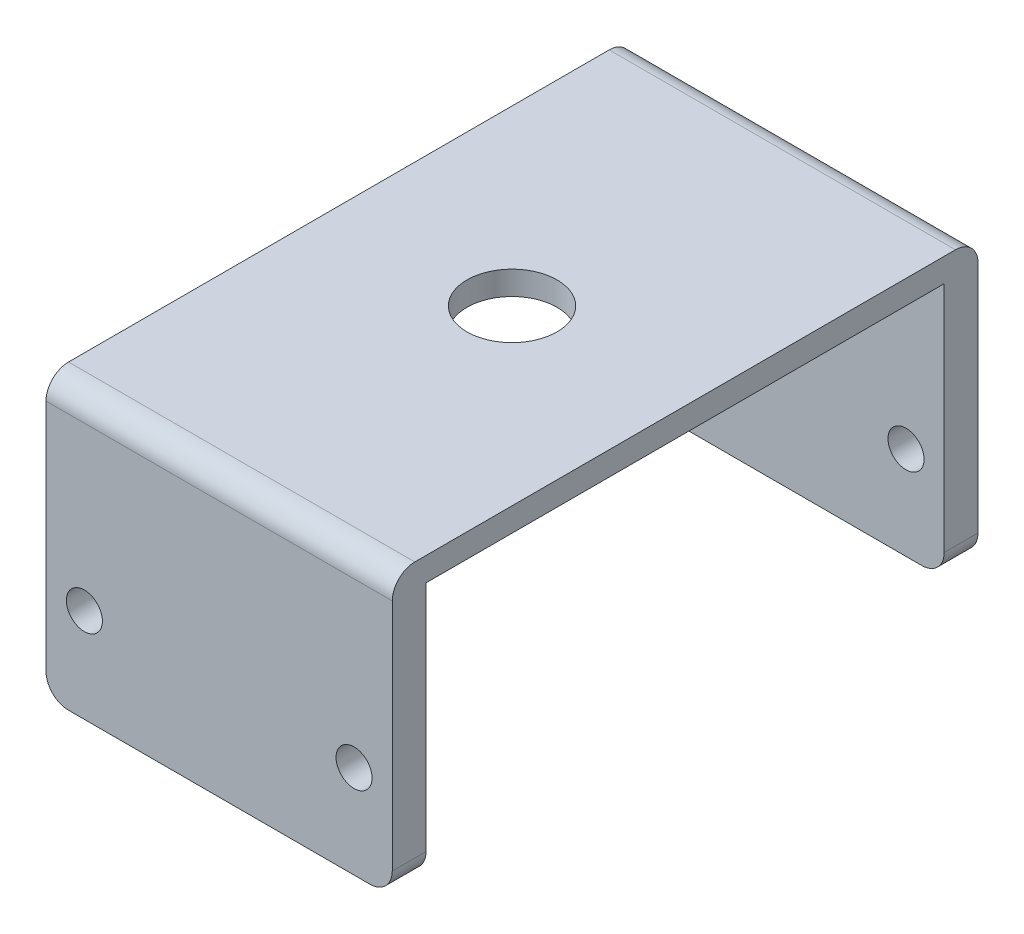
from build123d import *
from build123d.topology import SkipClean

# Parameters (mm, degrees)
SKETCH_1_W               = 30
SKETCH_1_H               = 65
EXTRUDE_1_DEPTH          = 48
SKETCH_2_R               = 1
CUT_EXTRUDE_1_DEPTH      = 48
EXTRUDE_2_DEPTH          = 5
EXTRUDE_2_DEPTH_BACK     = 53
SKETCH_3_R               = 3
CHAMFER_1_SIZE           = 2
FILLET_1_R               = 1
FILLET_2_R               = 1
SKETCH_6_R               = 1.6
CUT_EXTRUDE_3_DEPTH      = 76
EXTRUDE_3_DEPTH          = 50
EXTRUDE_3_DEPTH_BACK     = 2
SKETCH_7_W               = 30.741029275
SKETCH_7_H               = 24.773895079
SKETCH_7_R               = 1.6
CUT_EXTRUDE_START        = -30.741029275
CUT_EXTRUDE_4_DEPTH      = 30.741029275
CUT_EXTRUDE_5_DEPTH      = 50
CUT_EXTRUDE_5_DEPTH_BACK = 50
SKETCH_9_R               = 4
FILLET_3_R               = 2


# Read off the part's stored shape, not the designer's step: ｶｯﾄ - 押し出し4
with BuildPart() as part:
    # ｽｹｯﾁ1 → ﾎﾞｽ - 押し出し1 (new body)
    with BuildSketch(Plane.XY):
        with Locations((44.026916893, 39.150883092)):
            Rectangle(SKETCH_1_W, SKETCH_1_H)
    extrude(amount=EXTRUDE_1_DEPTH)

    # ｽｹｯﾁ2 → ｶｯﾄ - 押し出し1 (cut)
    with BuildSketch(Plane.XY):
        with Locations((56.026916893, 57.650883092)):
            Circle(SKETCH_2_R)
        with Locations((44.026916893, 57.650883092)):
            Circle(SKETCH_2_R)
        with Locations((56.023819064, 45.923533591)):
            Circle(SKETCH_2_R)
        with Locations((32.026916893, 57.650883092)):
            Circle(SKETCH_2_R)
        with Locations(Location((32.030014722, 45.923533591, 0), (0, 0, 180))):
            Circle(SKETCH_2_R)
    extrude(amount=CUT_EXTRUDE_1_DEPTH, mode=Mode.SUBTRACT)

    # ｽｹｯﾁ3 → ﾎﾞｽ - 押し出し2 (add, two sides: drawn at the far end of the back side and taken through both)
    with BuildSketch(Plane(origin=(0, 0, 0), x_dir=(-1, 0, 0), z_dir=(0, 0, -1)).offset(-EXTRUDE_2_DEPTH_BACK)):
        with Locations((-44.026916893, 18.650883092)):
            Circle(SKETCH_3_R)
    extrude(amount=EXTRUDE_2_DEPTH + EXTRUDE_2_DEPTH_BACK)

    # 面取り1
    chamfer_1_edges = [part.edges().sort_by_distance(p)[0] for p in [
        (29.026916893, 71.650883092, 24),
        (59.026916893, 71.650883092, 24),
        (59.026916893, 6.650883092, 24),
        (29.026916893, 6.650883092, 24),
    ]]
    chamfer(chamfer_1_edges, length=CHAMFER_1_SIZE)

    # ﾌｨﾚｯﾄ1
    fillet_1_edges = [part.edges().sort_by_distance(p)[0] for p in [
        (44.026916893, 6.650883092, 48),
        (29.026916893, 39.150883092, 48),
        (59.026916893, 39.150883092, 48),
        (44.026916893, 71.650883092, 48),
        (30.026916893, 70.650883092, 48),
        (58.026916893, 70.650883092, 48),
        (58.026916893, 7.650883092, 48),
        (30.026916893, 7.650883092, 48),
    ]]
    fillet(fillet_1_edges, radius=FILLET_1_R)

    # ﾌｨﾚｯﾄ2
    fillet_2_edges = [part.edges().sort_by_distance(p)[0] for p in [
        (44.026916893, 6.650883092, 0),
        (29.026916893, 39.150883092, 0),
        (44.026916893, 71.650883092, 0),
        (59.026916893, 39.150883092, 0),
        (30.026916893, 70.650883092, 0),
        (58.026916893, 70.650883092, 0),
        (58.026916893, 7.650883092, 0),
        (30.026916893, 7.650883092, 0),
    ]]
    fillet(fillet_2_edges, radius=FILLET_2_R)

    # ｽｹｯﾁ6 → ｶｯﾄ - 押し出し3 (cut)
    with BuildSketch(Plane(origin=(0, 0, 0), x_dir=(-1, 0, 0), z_dir=(0, 0, -1))):
        with Locations((-55.99912174, 57.606952707)):
            Circle(SKETCH_6_R)
        with Locations((-32.054712046, 57.694813478)):
            Circle(SKETCH_6_R)
        with Locations((-55.99912174, 45.879603206)):
            Circle(SKETCH_6_R)
        with Locations((-32.054712046, 45.967463976)):
            Circle(SKETCH_6_R)
    extrude(amount=-CUT_EXTRUDE_3_DEPTH, mode=Mode.SUBTRACT)

    # ｽｹｯﾁ7 → ﾎﾞｽ - 押し出し3 (add, two sides: drawn at the far end of the back side and taken through both)
    with SkipClean():  # the faces are left unmerged after this step: merging them gives an invalid solid
        with BuildSketch(Plane.XY.offset(-EXTRUDE_3_DEPTH_BACK)):
            with Locations((44.019576577, 61.733784516)):
                Rectangle(SKETCH_7_W, SKETCH_7_H)
            with Locations((32.054712046, 57.694813478)):
                Circle(SKETCH_7_R, mode=Mode.SUBTRACT)
            with Locations((55.99912174, 57.606952707)):
                Circle(SKETCH_7_R, mode=Mode.SUBTRACT)
        extrude(amount=EXTRUDE_3_DEPTH + EXTRUDE_3_DEPTH_BACK)

    # ｶｯﾄ - 押し出し4 outline → ｶｯﾄ - 押し出し4 (cut)
    with SkipClean():  # the faces are left unmerged after this step: merging them gives an invalid solid
        with BuildSketch(Plane(origin=(59.390091214, 0, 0), x_dir=(0, 0, -1), z_dir=(1, 0, 0)).offset(CUT_EXTRUDE_START)):
            Polygon((-1, 49.346836976), (-1, 72.013202711), (-47, 72.013202711), (-47, 49.346836976), (-48, 49.346836976), (-48, 45.206300999), (-57.188140565, 45.206300999), (-57.188140565, 1.456905632), (13.746291121, 1.456905632), (13.746291121, 49.346836976), align=None)
        extrude(amount=CUT_EXTRUDE_4_DEPTH, mode=Mode.SUBTRACT)

    # ｽｹｯﾁ9 → ｶｯﾄ - 押し出し5 (cut, two sides: drawn at the far end of the back side and taken through both)
    with SkipClean():  # the faces are left unmerged after this step: merging them gives an invalid solid
        with BuildSketch(Plane(origin=(0, 74.120732055, 0), x_dir=(1, 0, 0), z_dir=(0, 1, 0)).offset(-CUT_EXTRUDE_5_DEPTH_BACK)):
            with Locations(Location((44.019576577, -24, 0), (0, 0, 270))):
                Circle(SKETCH_9_R)
        extrude(amount=CUT_EXTRUDE_5_DEPTH + CUT_EXTRUDE_5_DEPTH_BACK, mode=Mode.SUBTRACT)

    # ﾌｨﾚｯﾄ3
    fillet_3_edges = [part.edges().sort_by_distance(p)[0] for p in [
        (28.649061939, 49.346836976, -0.5),
        (44.019576577, 74.120732055, -2),
        (59.390091214, 49.346836976, -0.5),
        (44.019576577, 74.120732055, 50),
        (59.390091214, 49.346836976, 49),
        (28.649061939, 49.346836976, 49),
    ]]
    fillet(fillet_3_edges, radius=FILLET_3_R)


solid = part.part
